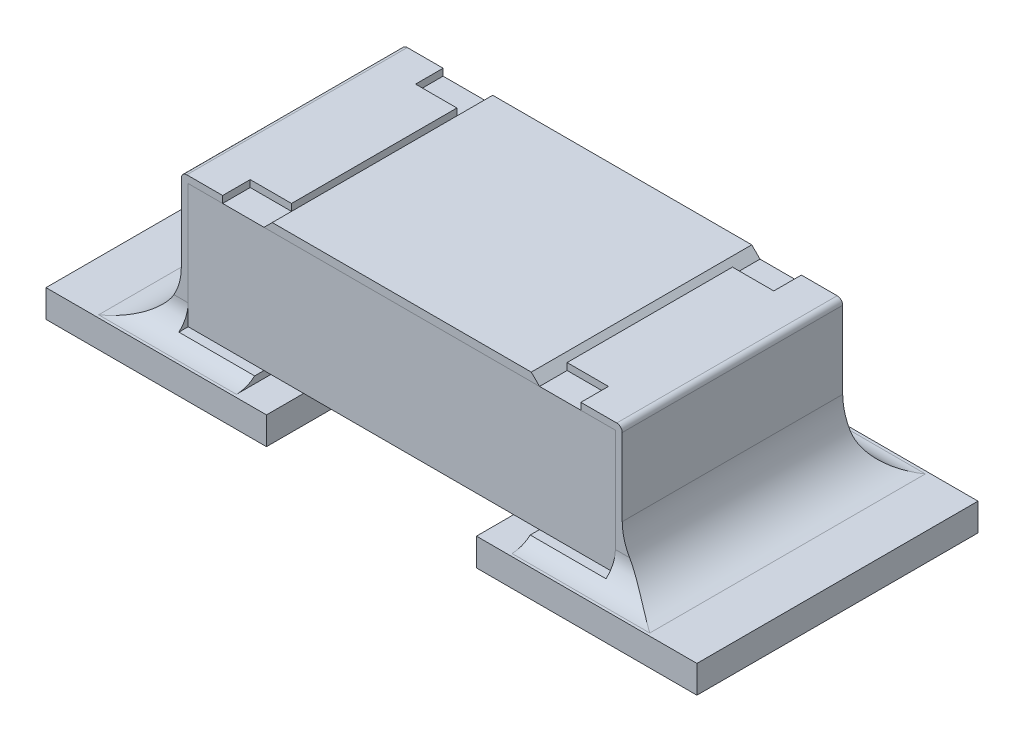
from build123d import *

# Parameters (mm, degrees)
SKETCH1_W             = 0.8
SKETCH1_H             = 0.45
BOSS_EXTRUDE1_DEPTH   = 0.775
BOSS_EXTRUDE2_DEPTH   = 0.4
BOSS_EXTRUDE2_2_DEPTH = 0.4
SKETCH3_W             = 0.15
SKETCH3_H             = 0.1
CUT_EXTRUDE1_DEPTH    = 0.025
BOSS_EXTRUDE3_DEPTH   = 0.4
SKETCH7_W             = 0.8
SKETCH7_H             = 1.02
BOSS_EXTRUDE5_DEPTH   = 0.1
FILLET3_R             = 0.2
FILLET4_R             = 0.2
FILLET5_R             = 0.1
FILLET6_R             = 0.1


with BuildPart() as part:
    # Sketch1 → Boss-Extrude1 (new, symmetric)
    with BuildSketch(Plane(origin=(0, 0, 0), x_dir=(0, 0, -1), z_dir=(1, 0, 0))):
        with Locations((0, 0.35)):
            Rectangle(SKETCH1_W, SKETCH1_H)
    extrude(amount=BOSS_EXTRUDE1_DEPTH, both=True)


with BuildPart() as body_2:
    # Sketch2 → Boss-Extrude2 (new, symmetric)
    with BuildSketch(Plane.XY):
        with BuildLine():
            Line((-0.5, 0.6), (-0.78, 0.6))
            ThreePointArc((-0.78, 0.6), (-0.794142136, 0.594142136), (-0.8, 0.58))
            Line((-0.8, 0.58), (-0.8, 0.1))
            Line((-0.8, 0.1), (-0.5, 0.1))
            Line((-0.5, 0.1), (-0.5, 0.125))
            Line((-0.5, 0.125), (-0.775, 0.125))
            Line((-0.775, 0.125), (-0.775, 0.575))
            Line((-0.775, 0.575), (-0.5, 0.575))
            Line((-0.5, 0.575), (-0.5, 0.6))
        make_face()
    extrude(amount=BOSS_EXTRUDE2_DEPTH, both=True)


with BuildPart() as body_3:
    # Sketch2 → Boss-Extrude2 2 (new, symmetric)
    with BuildSketch(Plane.XY):
        with BuildLine():
            Line((0.5, 0.575), (0.5, 0.6))
            Line((0.5, 0.6), (0.78, 0.6))
            ThreePointArc((0.78, 0.6), (0.794142136, 0.594142136), (0.8, 0.58))
            Line((0.8, 0.58), (0.8, 0.1))
            Line((0.8, 0.1), (0.5, 0.1))
            Line((0.5, 0.1), (0.5, 0.125))
            Line((0.5, 0.125), (0.775, 0.125))
            Line((0.775, 0.125), (0.775, 0.575))
            Line((0.775, 0.575), (0.5, 0.575))
        make_face()
    extrude(amount=BOSS_EXTRUDE2_2_DEPTH, both=True)


with BuildPart() as cut_extrude1_tool:
    # Sketch3 → Cut-Extrude1 (new body)
    with BuildSketch(Plane(origin=(0, 0.6, 0), x_dir=(1, 0, 0), z_dir=(0, 1, 0))):
        with Locations((-0.575, 0.35)):
            Rectangle(SKETCH3_W, SKETCH3_H)
        with Locations((-0.575, -0.35)):
            Rectangle(SKETCH3_W, SKETCH3_H)
        with Locations((0.575, -0.35)):
            Rectangle(SKETCH3_W, SKETCH3_H)
        with Locations((0.575, 0.35)):
            Rectangle(SKETCH3_W, SKETCH3_H)
    extrude(amount=-CUT_EXTRUDE1_DEPTH)


with BuildPart() as body_2_1:
    add(body_2.part)

    # Cut-Extrude1: cut by cut_extrude1_tool
    add(cut_extrude1_tool.part, mode=Mode.SUBTRACT)



with BuildPart() as body_3_1:
    add(body_3.part)

    # Cut-Extrude1: cut by cut_extrude1_tool
    add(cut_extrude1_tool.part, mode=Mode.SUBTRACT)


with BuildPart() as body_4:
    # Sketch4 → Boss-Extrude3 (new, symmetric)
    with BuildSketch(Plane.XY):
        Polygon((-0.5, 0.575), (0.5, 0.575), (0.47, 0.605), (-0.47, 0.605), align=None)
    extrude(amount=BOSS_EXTRUDE3_DEPTH, both=True)


with BuildPart() as body_2_2:
    add(body_2_1.part)

    add(body_3_1.part)  # Boss-Extrude5 merges body 3
    # Sketch7 → Boss-Extrude5 (add)
    with BuildSketch(Plane(origin=(0, 0, 0), x_dir=(1, 0, 0), z_dir=(0, 1, 0))):
        with Locations((-0.781, 0)):
            Rectangle(SKETCH7_W, SKETCH7_H)
        with Locations((0.781, 0)):
            Rectangle(SKETCH7_W, SKETCH7_H)
    extrude(amount=BOSS_EXTRUDE5_DEPTH)

    # Fillet3
    fillet3_edges = [body_2_2.edges().sort_by_distance(p)[0] for p in [
        (-0.8, 0.1, 0),
    ]]
    fillet(fillet3_edges, radius=FILLET3_R)

    # Fillet4
    fillet4_edges = [body_2_2.edges().sort_by_distance(p)[0] for p in [
        (0.8, 0.1, 0),
    ]]
    fillet(fillet4_edges, radius=FILLET4_R)

    # Fillet5
    fillet5_edges = [body_2_2.edges().sort_by_distance(p)[0] for p in [
        (0.75, 0.1, 0.4),
    ]]
    fillet(fillet5_edges, radius=FILLET5_R)
    fillet5_2_edges = [body_2_2.edges().sort_by_distance(p)[0] for p in [
        (0.75, 0.1, -0.4),
    ]]
    fillet(fillet5_2_edges, radius=FILLET5_R)

    # Fillet6
    fillet6_edges = [body_2_2.edges().sort_by_distance(p)[0] for p in [
        (-0.75, 0.1, -0.4),
    ]]
    fillet(fillet6_edges, radius=FILLET6_R)
    fillet6_2_edges = [body_2_2.edges().sort_by_distance(p)[0] for p in [
        (-0.75, 0.1, 0.4),
    ]]
    fillet(fillet6_2_edges, radius=FILLET6_R)


solid = Compound([part.part, body_4.part, body_2_2.part])
